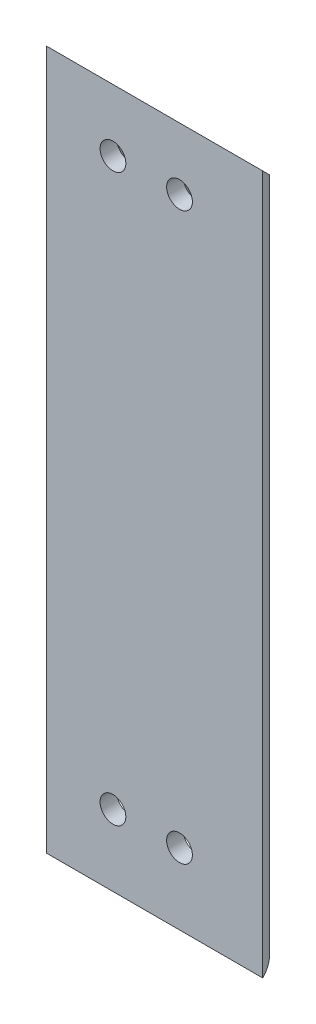
from build123d import *

# Parameters (mm, degrees)
BOSS_EXTRUDE1_DEPTH          = 66.675
FILLET1_R                    = 3.175
CUT_EXTRUDE1_DEPTH           = 84.460840368
F_10_0_1935_DIAMETER_HOLE1_D = 4.9149


with BuildPart() as part:
    # Sketch1 → Boss-Extrude1 (new, symmetric)
    with BuildSketch(Plane(origin=(0, 0, 0), x_dir=(1, 0, 0), z_dir=(0, 1, 0))):
        Polygon((0, 28.575), (0, 0), (41.275, 0), (41.275, 3.175), (3.175, 3.175), (3.175, 28.575), align=None)
    extrude(amount=BOSS_EXTRUDE1_DEPTH, both=True)

    # Fillet1
    fillet1_edges = [part.edges().sort_by_distance(p)[0] for p in [
        (41.275, 0, -3.175),
        (3.175, 0, -28.575),
    ]]
    fillet(fillet1_edges, radius=FILLET1_R - 0.0001)  # a hair under: the kernel refuses the full size

    # Sketch4 → Cut-Extrude1 (cut, through all)
    with BuildSketch(Plane.ZY):
        Polygon((0, -66.675), (-28.575, -38.1), (-28.575, -66.675), align=None)
        Polygon((0, 66.675), (-28.575, 38.1), (-28.575, 66.675), align=None)
    extrude(amount=-CUT_EXTRUDE1_DEPTH, mode=Mode.SUBTRACT)

    # #10 (0.1935) Diameter Hole1 (through all)
    with Locations(Plane(origin=(0, 0, -3.175), x_dir=(-1, 0, 0), z_dir=(0, 0, -1))):
        with Locations((-25.4, -53.092781609), (-12.7, -53.092781609), (-12.7, 54.857218391), (-25.4, 54.857218391)):
            Hole(F_10_0_1935_DIAMETER_HOLE1_D / 2)


solid = part.part
